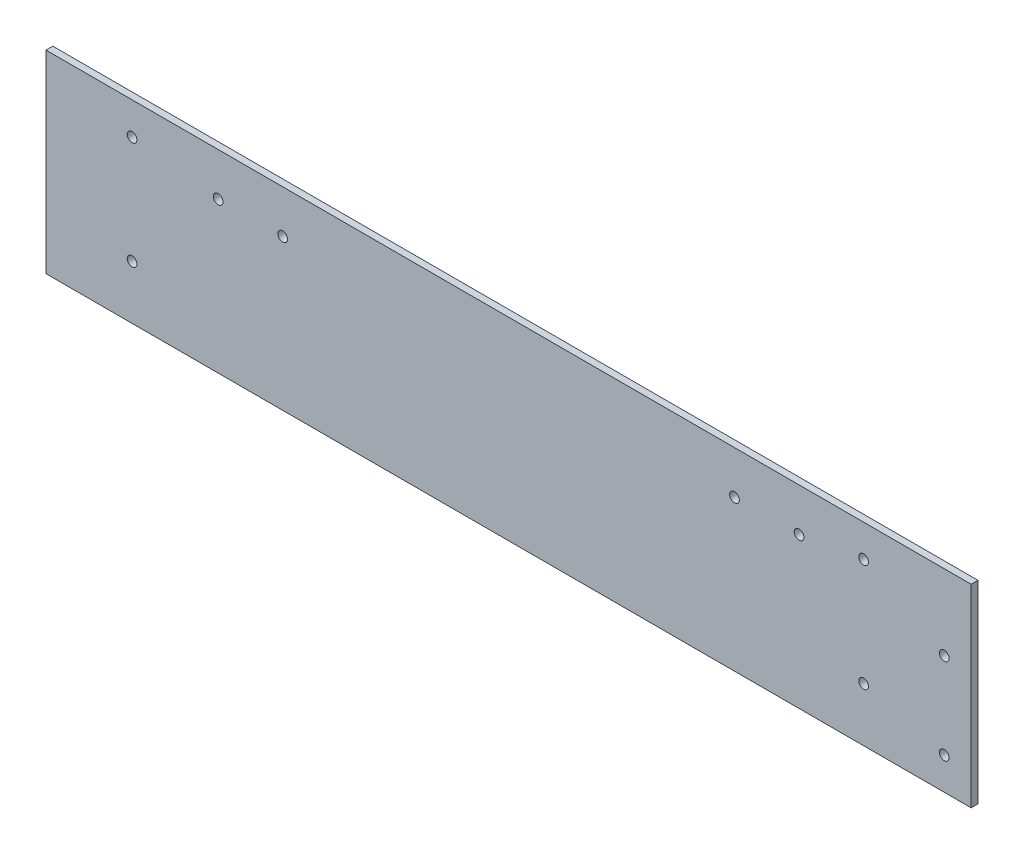
from build123d import *

# Parameters (mm, degrees)
SKETCH1_W            = 430
SKETCH1_H            = 90
BOSS_EXTRUDE1_DEPTH  = 3.175
M4_CLEARANCE_HOLE1_D = 4.5
M4_CLEARANCE_HOLE2_D = 4.5
M4_CLEARANCE_HOLE3_D = 4.5


with BuildPart() as part:
    # Sketch1 → Boss-Extrude1 (new body)
    with BuildSketch(Plane.XY):
        Rectangle(SKETCH1_W, SKETCH1_H)
    extrude(amount=BOSS_EXTRUDE1_DEPTH)

    # M4 Clearance Hole1 (through all)
    with Locations(Plane.XY.offset(3.175)):
        with Locations((165, 30), (-175, -20), (-175, 30), (165, -20)):
            Hole(M4_CLEARANCE_HOLE1_D / 2)

    # M4 Clearance Hole2 (through all)
    with Locations(Plane.XY.offset(3.175)):
        with Locations((-135, 25), (-105, 25)):
            m4_clearance_hole2 = Hole(M4_CLEARANCE_HOLE2_D / 2)

    # Mirror1: M4 Clearance Hole2 across plane
    add(m4_clearance_hole2.mirror(Plane(origin=(0, 0, 0), x_dir=(0, 0, 1), z_dir=(1, 0, 0))), mode=Mode.SUBTRACT)

    # M4 Clearance Hole3 (through all)
    with Locations(Plane.XY.offset(3.175)):
        with Locations((202.5, -30), (202.5, 10)):
            Hole(M4_CLEARANCE_HOLE3_D / 2)


solid = part.part
